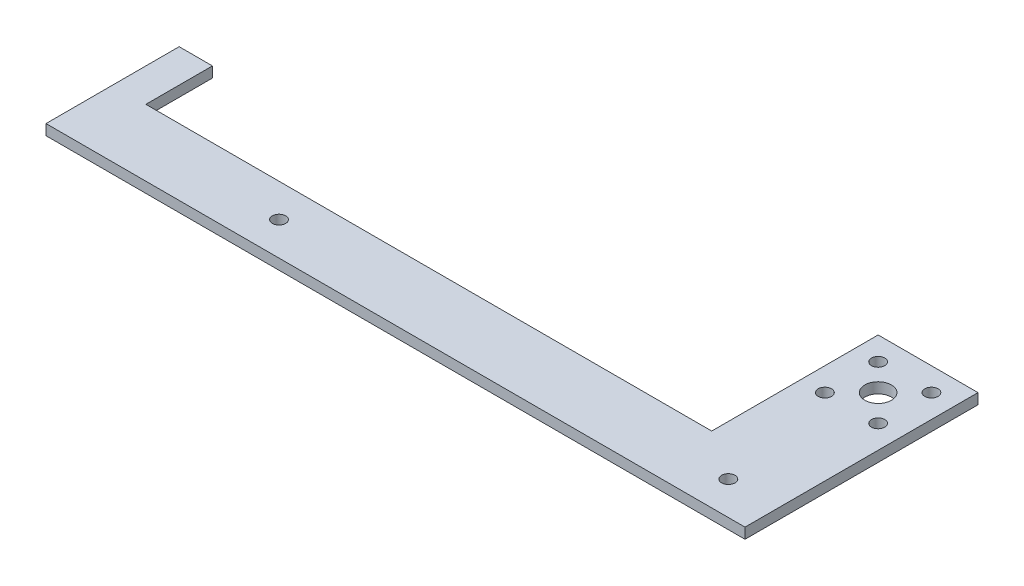
from build123d import *

# Parameters (mm, degrees)
SKETCH1_R           = 2
SKETCH1_R_2         = 4
BOSS_EXTRUDE1_DEPTH = 3.175


with BuildPart() as part:
    # Sketch1 → Boss-Extrude1 (new body)
    with BuildSketch(Plane(origin=(0, 0, 0), x_dir=(1, 0, 0), z_dir=(0, 1, 0))):
        Polygon((200, 30), (170, 30), (170, -20), (0, -20), (0, 0), (-10, 0), (-10, -40), (200, -40), align=None)
        with Locations((185, -30)):
            Circle(SKETCH1_R, mode=Mode.SUBTRACT)
        with Locations((50, -30)):
            Circle(SKETCH1_R, mode=Mode.SUBTRACT)
        with Locations((177, 23)):
            Circle(SKETCH1_R, mode=Mode.SUBTRACT)
        with Locations((177, 7)):
            Circle(SKETCH1_R, mode=Mode.SUBTRACT)
        with Locations((193, 7)):
            Circle(SKETCH1_R, mode=Mode.SUBTRACT)
        with Locations((193, 23)):
            Circle(SKETCH1_R, mode=Mode.SUBTRACT)
        with Locations((185, 15)):
            Circle(SKETCH1_R_2, mode=Mode.SUBTRACT)
    extrude(amount=BOSS_EXTRUDE1_DEPTH)


solid = part.part
